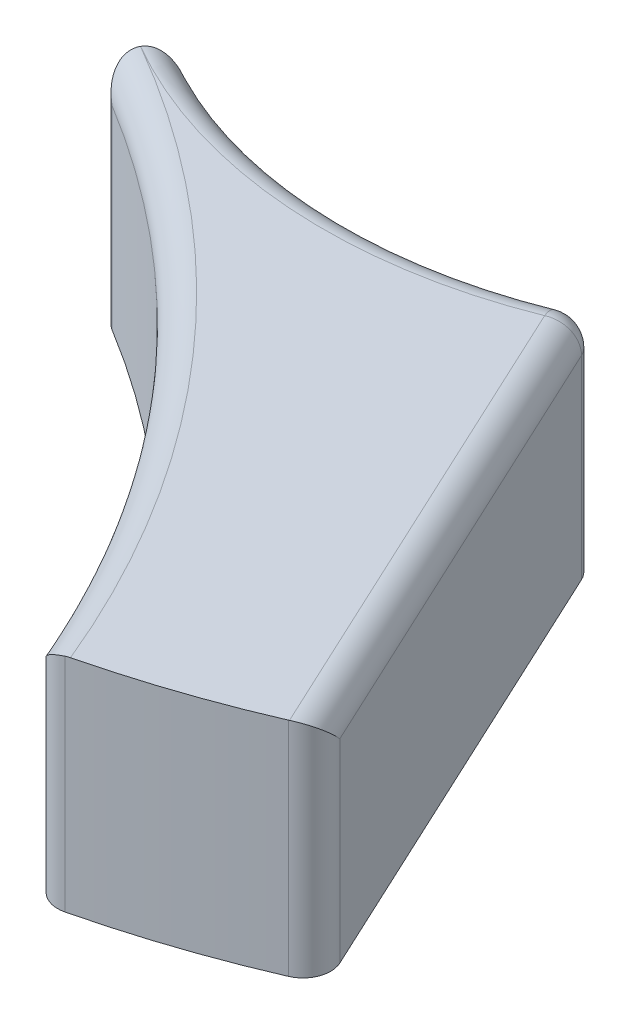
from build123d import *
from build123d.topology import SkipClean

# Parameters (mm, degrees)
SWEEP_2_DEPTH        = 3
SKETCH_15_W          = 3
SKETCH_15_H          = 8
SKETCH_17_W          = 3
SKETCH_17_H          = 8
REVOLVE_1_ANGLE      = 60
SKETCH_20_R          = 26.546275206
EXTRUDE_1_DEPTH      = 3
SKETCH_21_R          = 12.5
CUT_EXTRUDE_1_DEPTH  = 10
CUT_EXTRUDE_2_REACH  = 67.765
SKETCH_22_R          = 17
EXTRUDE_START        = 22
SKETCH_23_R          = 16.5
SKETCH_23_R_2        = 12.5
EXTRUDE_2_DEPTH      = 22
SKETCH_24_R          = 70.041464106
CUT_EXTRUDE_3_DEPTH  = 10
SKETCH_27_R          = 3
EXTRUDE_4_DEPTH      = 5
SKETCH_28_R          = 1.4
CUT_EXTRUDE_4_DEPTH  = 66.76473219
EXTRUDE_5_DEPTH      = 15
EXTRUDE_5_DEPTH_BACK = 3
SKETCH_30_R          = 1.4
EXTRUDE_6_DEPTH      = 3
EXTRUDE_9_DEPTH      = 8
SKETCH_34_R          = 1.5
CUT_EXTRUDE_5_DEPTH  = 13
SKETCH_35_R          = 57
SKETCH_35_R_2        = 37
CUT_EXTRUDE_6_DEPTH  = 69.556546004
FILLET_1_R           = 1
SKETCH_36_R          = 1.5
EXTRUDE_10_DEPTH     = 4
SKETCH_37_R          = 2
SKETCH_37_R_2        = 2.15
CUT_EXTRUDE_7_DEPTH  = 4


# Read off the part's stored shape, not the designer's step: 扫描2
with BuildPart() as part:
    # 扫描2 outline → 扫描2 (new body)
    with BuildSketch(Plane(origin=(0, 0, 0), x_dir=(1, 0, 0), z_dir=(0, 1, 0))):
        with BuildLine():
            ThreePointArc((-20, -34.641016151), (-12.679491924, -41.961524227), (-10, -51.961524227))
            Line((-10, -51.961524227), (11, -51.961524227))
            ThreePointArc((11, -51.961524227), (10.470745096, -45.395034193), (8.896644323, -38.998073283))
            ThreePointArc((8.896644323, -38.998073283), (5.963817028, 39.55291249), (-20, -34.641016151))
        make_face()
        with BuildLine():
            ThreePointArc((0, -24.015147002), (-4.46857992, -19.881209566), (-9.5, -16.454482672))
            ThreePointArc((-9.5, -16.454482672), (4.917561857, 18.352590699), (0, -19))
            Line((0, -19), (0, -24.015147002))
        make_face(mode=Mode.SUBTRACT)
    extrude(amount=SWEEP_2_DEPTH)

    # 扫描3: sweep along a path in 草图16
    with BuildLine(Plane(origin=(0, 3, 0), x_dir=(1, 0, 0), z_dir=(0, 1, 0))) as sweep_3_path:
        ThreePointArc((-10, -51.961524227), (-12.679491924, -41.961524227), (-20, -34.641016151))
        ThreePointArc((-20, -34.641016151), (5.963817027, 39.55291249), (8.896644323, -38.998073283))
    # 草图15 → 扫描3 (sweep)
    with BuildSketch(Plane.XY.offset(51.961524227)):
        with Locations((-8.5, 4)):
            Rectangle(SKETCH_15_W, SKETCH_15_H)
    sweep(path=sweep_3_path.line)

    # 草图17 → 旋转1 (revolve)
    with BuildSketch(Plane.XY.offset(51.961524227)):
        with Locations((12.5, 4)):
            Rectangle(SKETCH_17_W, SKETCH_17_H)
    revolve(axis=Axis((-30, 3, 51.961524227), (0, 1, 0)), revolution_arc=REVOLVE_1_ANGLE)

    # 草图20 → 凸台-拉伸1 (add)
    with BuildSketch(Plane(origin=(0, 3, 0), x_dir=(1, 0, 0), z_dir=(0, 1, 0))):
        Circle(SKETCH_20_R)
    extrude(amount=-EXTRUDE_1_DEPTH)

    # 草图21 → 切除-拉伸1 (cut)
    with BuildSketch(Plane(origin=(0, 3, 0), x_dir=(1, 0, 0), z_dir=(0, 1, 0))):
        with Locations(Location((0, 0, 0), (0, 0, 270))):
            Circle(SKETCH_21_R)
    extrude(amount=-CUT_EXTRUDE_1_DEPTH, mode=Mode.SUBTRACT)

    # 草图22 → 切除-拉伸2 (cut, up to next)
    with BuildSketch(Plane(origin=(0, 3, 0), x_dir=(1, 0, 0), z_dir=(0, 1, 0)), mode=Mode.PRIVATE) as cut_extrude_2_sk1:
        Circle(SKETCH_22_R)
    cut_extrude_2_tool1 = extrude(cut_extrude_2_sk1.sketch, amount=CUT_EXTRUDE_2_REACH, mode=Mode.PRIVATE) & part.part
    add(cut_extrude_2_tool1.solids().sort_by_distance((0, 3, 0))[0], mode=Mode.SUBTRACT)

    # 草图23 → 凸台-拉伸2 (add)
    with BuildSketch(Plane(origin=(0, 3, 0), x_dir=(1, 0, 0), z_dir=(0, 1, 0)).offset(EXTRUDE_START)):
        with Locations(Location((0, 0, 0), (0, 0, 270))):
            Circle(SKETCH_23_R)
        with Locations(Location((0, 0, 0), (0, 0, 270))):
            Circle(SKETCH_23_R_2, mode=Mode.SUBTRACT)
    extrude(amount=-EXTRUDE_2_DEPTH)

    # 草图24 → 切除-拉伸3 (cut)
    with BuildSketch(Plane(origin=(0, 3, 0), x_dir=(1, 0, 0), z_dir=(0, 1, 0))):
        Circle(SKETCH_24_R)
    extrude(amount=-CUT_EXTRUDE_3_DEPTH, mode=Mode.SUBTRACT)


with BuildPart() as cut_extrude_3_kept_piece:
    # of the separate pieces the step leaves, the one the design keeps (cut_extrude_3_pieces_kept)
    add(part.part.solids().sort_by_distance((-20, 8, 34.641016151))[0])

    # 草图27 → 凸台-拉伸4 (add)
    with BuildSketch(Plane(origin=(0, 8, 0), x_dir=(1, 0, 0), z_dir=(0, 1, 0))):
        with Locations((0, 40)):
            Circle(SKETCH_27_R)
        with Locations((34.641016151, 20)):
            Circle(SKETCH_27_R)
        with Locations((34.641016151, -20)):
            Circle(SKETCH_27_R)
        with Locations((-34.641016151, -20)):
            Circle(SKETCH_27_R)
        with Locations((-34.641016151, 20)):
            Circle(SKETCH_27_R)
    extrude(amount=-EXTRUDE_4_DEPTH)

    # 草图28 → 切除-拉伸4 (cut, through all)
    with BuildSketch(Plane(origin=(0, 8, 0), x_dir=(1, 0, 0), z_dir=(0, 1, 0))):
        with Locations(Location((0, 40, 0), (0, 0, 270))):
            Circle(SKETCH_28_R)
        with Locations(Location((34.641016151, 20, 0), (0, 0, 270))):
            Circle(SKETCH_28_R)
        with Locations(Location((34.641016151, -20, 0), (0, 0, 270))):
            Circle(SKETCH_28_R)
        with Locations((0, -40)):
            Circle(SKETCH_28_R)
        with Locations(Location((-34.641016151, -20, 0), (0, 0, 270))):
            Circle(SKETCH_28_R)
        with Locations(Location((-34.641016151, 20, 0), (0, 0, 270))):
            Circle(SKETCH_28_R)
    extrude(amount=-CUT_EXTRUDE_4_DEPTH, mode=Mode.SUBTRACT)

    # 草图30 → 凸台-拉伸5 (add, two sides: drawn at the far end of the back side and taken through both)
    # profile 1 of 2: a face of its own
    with BuildSketch(Plane(origin=(0, 8, 0), x_dir=(1, 0, 0), z_dir=(0, 1, 0)).offset(-EXTRUDE_5_DEPTH_BACK)):
        with BuildLine():
            ThreePointArc((-18.5, -32.04293994), (4.216428718, 36.758968006), (10.764012371, -35.399661547))
            Line((10.764012371, -35.399661547), (7.984647891, -36.528879457))
            ThreePointArc((7.984647891, -36.528879457), (10.239101404, -44.09929056), (11, -51.961524227))
            Line((11, -51.961524227), (14, -51.961524227))
            ThreePointArc((14, -51.961524227), (13.446319486, -45.003268476), (11.799212586, -38.220133207))
            ThreePointArc((11.799212586, -38.220133207), (23.753094696, -32.183699172), (33.044643352, -22.539998796))
            ThreePointArc((33.044643352, -22.539998796), (37.239092363, -21.5), (36.042533235, -17.347501204))
            ThreePointArc((36.042533235, -17.347501204), (40, 0), (36.042533235, 17.347501204))
            ThreePointArc((36.042533235, 17.347501204), (37.239092363, 21.5), (33.044643352, 22.539998796))
            ThreePointArc((33.044643352, 22.539998796), (20, 34.641016151), (2.997889883, 39.8875))
            ThreePointArc((2.997889883, 39.8875), (0, 43), (-2.997889883, 39.8875))
            ThreePointArc((-2.997889883, 39.8875), (-20, 34.641016151), (-33.044643352, 22.539998796))
            ThreePointArc((-33.044643352, 22.539998796), (-37.239092363, 21.5), (-36.042533235, 17.347501204))
            ThreePointArc((-36.042533235, 17.347501204), (-40, 0), (-36.042533235, -17.347501204))
            ThreePointArc((-36.042533235, -17.347501204), (-37.239092363, -21.5), (-33.044643352, -22.539998796))
            ThreePointArc((-33.044643352, -22.539998796), (-27.203716701, -29.325037044), (-20, -34.641016151))
            Line((-20, -34.641016151), (-18.5, -32.04293994))
        make_face()
        with Locations(Location((-34.641016151, -20, 0), (0, 0, 270))):
            Circle(SKETCH_30_R, mode=Mode.SUBTRACT)
        with Locations(Location((34.641016151, -20, 0), (0, 0, 270))):
            Circle(SKETCH_30_R, mode=Mode.SUBTRACT)
        with Locations(Location((-34.641016151, 20, 0), (0, 0, 270))):
            Circle(SKETCH_30_R, mode=Mode.SUBTRACT)
        with Locations(Location((0, 40, 0), (0, 0, 270))):
            Circle(SKETCH_30_R, mode=Mode.SUBTRACT)
        with Locations(Location((34.641016151, 20, 0), (0, 0, 270))):
            Circle(SKETCH_30_R, mode=Mode.SUBTRACT)
    # profile 2 of 2: a face of its own
    with BuildSketch(Plane(origin=(0, 8, 0), x_dir=(1, 0, 0), z_dir=(0, 1, 0)).offset(-EXTRUDE_5_DEPTH_BACK)):
        with BuildLine():
            Line((-20, -34.641016151), (-18.5, -32.04293994))
            ThreePointArc((-18.5, -32.04293994), (-10.081415713, -40.461524227), (-7, -51.961524227))
            Line((-7, -51.961524227), (-10, -51.961524227))
            ThreePointArc((-10, -51.961524227), (-12.679491924, -41.961524227), (-20, -34.641016151))
        make_face()
    extrude(amount=EXTRUDE_5_DEPTH + EXTRUDE_5_DEPTH_BACK)

    # 草图31 → 凸台-拉伸6 (add)
    with BuildSketch(Plane(origin=(0, 8, 0), x_dir=(1, 0, 0), z_dir=(0, 1, 0))):
        with BuildLine():
            Line((7.984647891, -36.528879457), (10.764012371, -35.399661547))
            ThreePointArc((10.764012371, -35.399661547), (4.742794362, -24.962667956), (-3.883880218, -16.550391973))
            ThreePointArc((-3.883880218, -16.550391973), (-6.259032022, -15.805838103), (-8.5, -14.722431864))
            Line((-8.5, -14.722431864), (-9.5, -16.454482672))
            ThreePointArc((-9.5, -16.454482672), (0.916967208, -25.033079439), (7.984647891, -36.528879457))
        make_face()
    extrude(amount=EXTRUDE_6_DEPTH)

    # 草图33 → 凸台-拉伸9 (add)
    with BuildSketch(Plane(origin=(0, 11, 0), x_dir=(1, 0, 0), z_dir=(0, 1, 0))):
        with BuildLine():
            Line((15.636875684, -33.53338812), (7.18451045, -15.40723238))
            ThreePointArc((7.18451045, -15.40723238), (1.746494616, -16.910048981), (-3.883880218, -16.550391973))
            ThreePointArc((-3.883880218, -16.550391973), (4.742794362, -24.962667956), (10.764012371, -35.399661547))
            ThreePointArc((10.764012371, -35.399661547), (13.23338455, -34.552532951), (15.636875684, -33.53338812))
        make_face()
    extrude(amount=-EXTRUDE_9_DEPTH)

    # 草图34 → 切除-拉伸5 (cut)
    with BuildSketch(Plane(origin=(0, 11, 0), x_dir=(1, 0, 0), z_dir=(0, 1, 0))):
        with Locations(Location((3.099042165, -20.843126869, 0), (0, 0, 270))):
            Circle(SKETCH_34_R)
        with Locations(Location((9.482973177, -29.801107938, 0), (0, 0, 270))):
            Circle(SKETCH_34_R)
    extrude(amount=-CUT_EXTRUDE_5_DEPTH, mode=Mode.SUBTRACT)

    # 草图35 → 切除-拉伸6 (cut, through all)
    with SkipClean():  # the faces are left unmerged after this step: merging them gives an invalid solid
        with BuildSketch(Plane.XZ.offset(-3)):
            Circle(SKETCH_35_R)
            Circle(SKETCH_35_R_2, mode=Mode.SUBTRACT)
        extrude(amount=-CUT_EXTRUDE_6_DEPTH, mode=Mode.SUBTRACT)

    # 圆角1
    fillet_1_edges = [cut_extrude_3_kept_piece.edges().sort_by_distance(p)[0] for p in [
        (15.636875684, 7, 33.53338812),
        (7.833230134, 7, 36.161312278),
        (7.18451045, 7, 15.40723238),
        (11.410693067, 11, 24.47031025),
        (0.786055573, 11, 24.883511334),
        (-9.5, 5.5, 16.454482672),
        (-8.5, 5.5, 14.722431864),
        (1.746494616, 11, 16.910048981),
    ]]
    fillet(fillet_1_edges, radius=FILLET_1_R - 0.0001)  # a hair under: the kernel refuses the full size

    # 草图36 → 凸台-拉伸10 (add)
    with BuildSketch(Plane(origin=(0, 11, 0), x_dir=(1, 0, 0), z_dir=(0, 1, 0))):
        with Locations(Location((9.482973177, -29.801107938, 0), (0, 0, 270))):
            Circle(SKETCH_36_R)
        with Locations(Location((3.099042165, -20.843126869, 0), (0, 0, 270))):
            Circle(SKETCH_36_R)
    extrude(amount=-EXTRUDE_10_DEPTH)

    # 草图37 → 切除-拉伸7 (cut)
    with BuildSketch(Plane.XZ.offset(-3)):
        with Locations(Location((3.099042165, 20.843126869, 0), (0, 0, 270))):
            Circle(SKETCH_37_R)
        with Locations(Location((9.482973177, 29.801107938, 0), (0, 0, 270))):
            Circle(SKETCH_37_R_2)
    extrude(amount=-CUT_EXTRUDE_7_DEPTH, mode=Mode.SUBTRACT)


solid = cut_extrude_3_kept_piece.part
